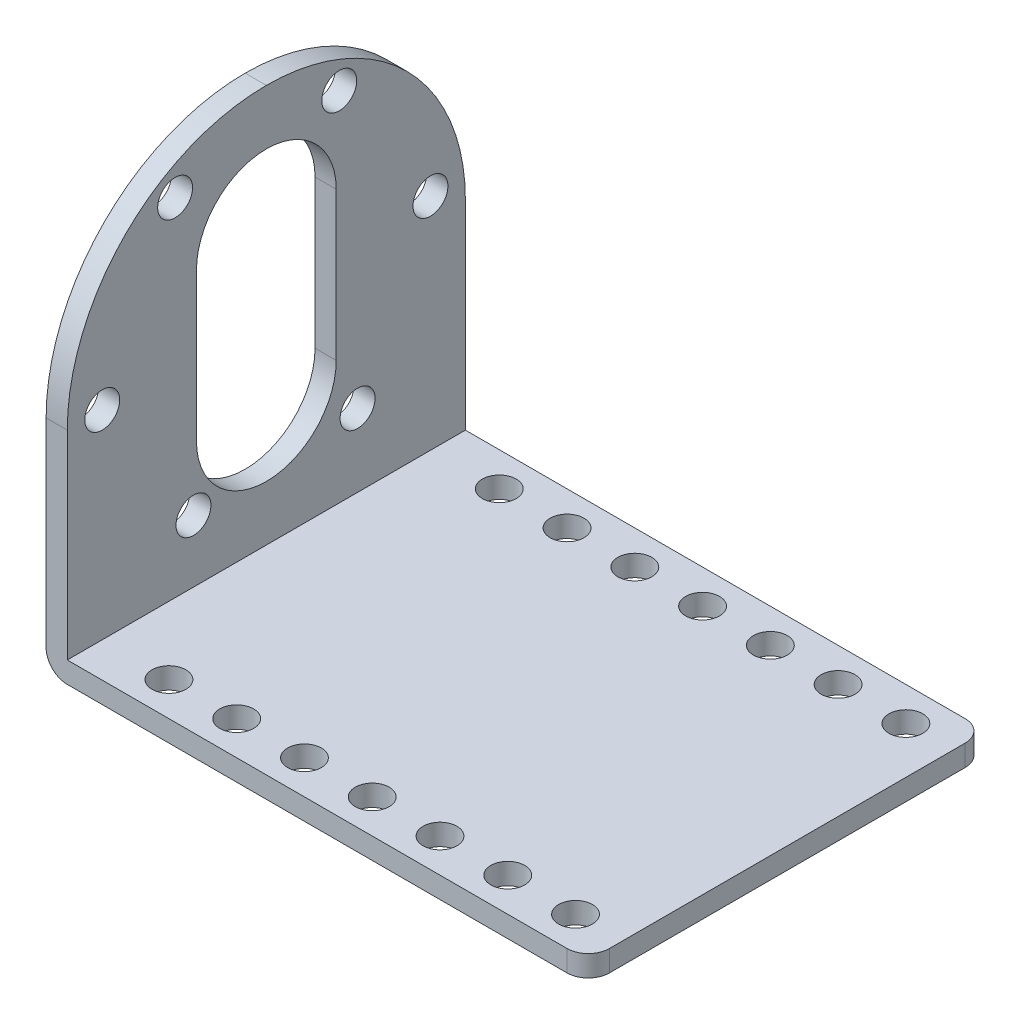
from build123d import *

# Parameters (mm, degrees)
SKETCH1_W           = 51.2
SKETCH1_H           = 37.6
BOSS_EXTRUDE1_DEPTH = 2
SKETCH2_W           = 2
SKETCH2_H           = 37.6
BOSS_EXTRUDE2_DEPTH = 37.6
SKETCH3_R           = 1.65
CUT_EXTRUDE2_DEPTH  = 37.6
SKETCH5_R           = 6.6
CUT_EXTRUDE3_DEPTH  = 37.6
SKETCH6_R           = 1.6
CUT_EXTRUDE4_DEPTH  = 37.6
FILLET1_R           = 2
FILLET2_R           = 2
FILLET3_R           = 18.8


with BuildPart() as part:
    # Sketch1 → Boss-Extrude1 (new body)
    with BuildSketch(Plane(origin=(0, 0, 0), x_dir=(1, 0, 0), z_dir=(0, 1, 0))):
        Rectangle(SKETCH1_W, SKETCH1_H)
    extrude(amount=BOSS_EXTRUDE1_DEPTH)

    # Sketch2 → Boss-Extrude2 (add)
    with BuildSketch(Plane(origin=(0, 2, 0), x_dir=(1, 0, 0), z_dir=(0, 1, 0))):
        with Locations((-24.6, 0)):
            Rectangle(SKETCH2_W, SKETCH2_H)
    extrude(amount=BOSS_EXTRUDE2_DEPTH)

    # Sketch3 → Cut-Extrude2 (cut)
    with BuildSketch(Plane.ZY.offset(25.6)):
        with Locations((15.5, 20.8)):
            Circle(SKETCH3_R)
        with Locations((6.883974596, 7.876606241)):
            Circle(SKETCH3_R)
        with Locations((-8.616025404, 8.876606241)):
            Circle(SKETCH3_R)
        with Locations((-15.5, 22.8)):
            Circle(SKETCH3_R)
        with Locations((-6.883974596, 35.723393759)):
            Circle(SKETCH3_R)
        with Locations((8.616025404, 34.723393759)):
            Circle(SKETCH3_R)
    extrude(amount=-CUT_EXTRUDE2_DEPTH, mode=Mode.SUBTRACT)

    # Sketch5 → Cut-Extrude3 (cut)
    with BuildSketch(Plane.ZY.offset(25.6)):
        with Locations((0, 27.8)):
            Circle(SKETCH5_R)
        with BuildLine():
            Line((6.6, 13.8), (6.6, 27.8))
            ThreePointArc((6.6, 27.8), (0, 21.2), (-6.6, 27.8))
            Line((-6.6, 27.8), (-6.6, 13.8))
            ThreePointArc((-6.6, 13.8), (0, 20.4), (6.6, 13.8))
        make_face()
        with Locations((0, 13.8)):
            Circle(SKETCH5_R)
    extrude(amount=-CUT_EXTRUDE3_DEPTH, mode=Mode.SUBTRACT)

    # Sketch6 → Cut-Extrude4 (cut)
    with BuildSketch(Plane(origin=(0, 0, 0), x_dir=(-1, 0, 0), z_dir=(0, -1, 0))):
        with Locations(Location((17.2, -15.6, 0), (0, 0, 90))):
            Circle(SKETCH6_R)
        with Locations(Location((10.8, -15.6, 0), (0, 0, 90))):
            Circle(SKETCH6_R)
        with Locations(Location((4.4, -15.6, 0), (0, 0, 90))):
            Circle(SKETCH6_R)
        with Locations(Location((-2, -15.6, 0), (0, 0, 90))):
            Circle(SKETCH6_R)
        with Locations(Location((-8.4, -15.6, 0), (0, 0, 90))):
            Circle(SKETCH6_R)
        with Locations(Location((-14.8, -15.6, 0), (0, 0, 90))):
            Circle(SKETCH6_R)
        with Locations(Location((-21.2, -15.6, 0), (0, 0, 90))):
            Circle(SKETCH6_R)
        with Locations(Location((-21.2, 15.6, 0), (0, 0, 270))):
            Circle(SKETCH6_R)
        with Locations(Location((-14.8, 15.6, 0), (0, 0, 270))):
            Circle(SKETCH6_R)
        with Locations(Location((-8.4, 15.6, 0), (0, 0, 270))):
            Circle(SKETCH6_R)
        with Locations(Location((-2, 15.6, 0), (0, 0, 270))):
            Circle(SKETCH6_R)
        with Locations(Location((4.4, 15.6, 0), (0, 0, 270))):
            Circle(SKETCH6_R)
        with Locations(Location((10.8, 15.6, 0), (0, 0, 270))):
            Circle(SKETCH6_R)
        with Locations(Location((17.2, 15.6, 0), (0, 0, 270))):
            Circle(SKETCH6_R)
    extrude(amount=-CUT_EXTRUDE4_DEPTH, mode=Mode.SUBTRACT)

    # Fillet1
    fillet1_edges = [part.edges().sort_by_distance(p)[0] for p in [
        (25.6, 1, -18.8),
        (25.6, 1, 18.8),
    ]]
    fillet(fillet1_edges, radius=FILLET1_R)

    # Fillet2
    fillet2_edges = [part.edges().sort_by_distance(p)[0] for p in [
        (-25.6, 0, 0),
    ]]
    fillet(fillet2_edges, radius=FILLET2_R)

    # Fillet3
    fillet3_edges = [part.edges().sort_by_distance(p)[0] for p in [
        (-24.6, 39.6, -18.8),
        (-24.6, 39.6, 18.8),
    ]]
    fillet(fillet3_edges, radius=FILLET3_R - 0.0001)  # a hair under: the kernel refuses the full size


solid = part.part
